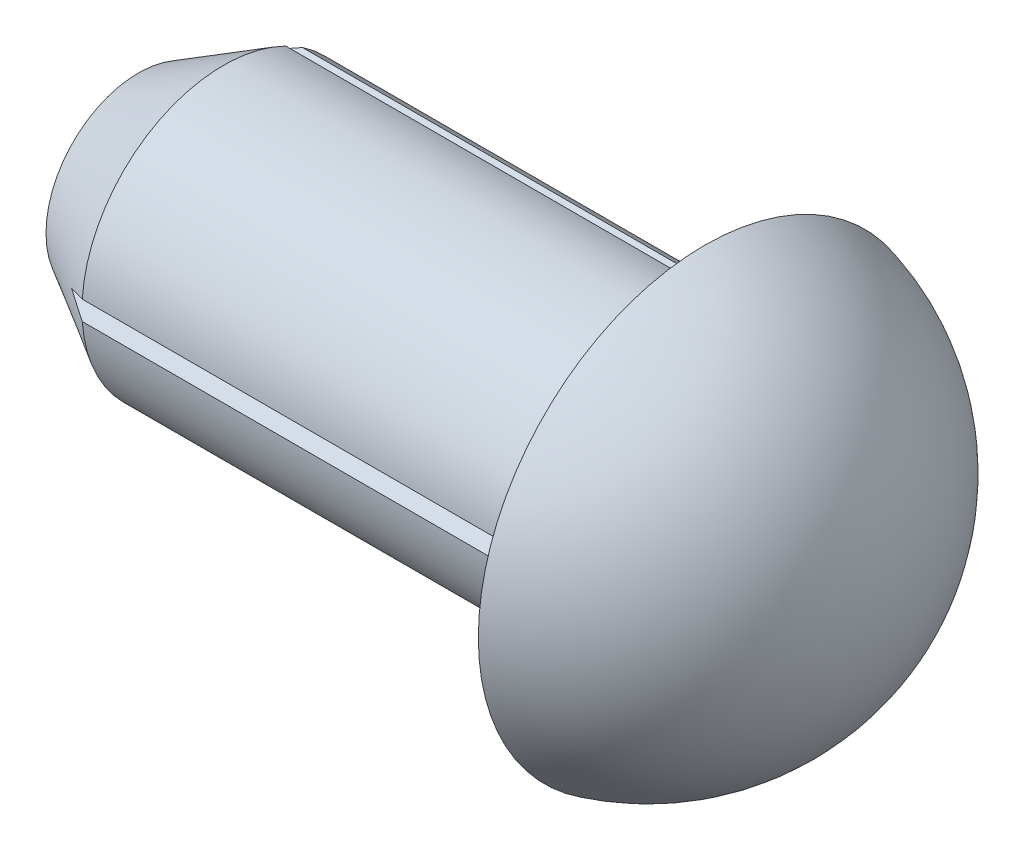
from build123d import *

# Parameters (mm, degrees)
CUT_EXTRUDE1_DEPTH = 37
CIRPATTERN1_COUNT  = 3


with BuildPart() as part:
    # Sketch1 → Base-Revolve (revolve)
    with BuildSketch(Plane.XY):
        with BuildLine():
            Line((-40, 0), (-40, 6.535898385))
            Line((-40, 6.535898385), (-34, 10))
            Line((-34, 10), (0, 10))
            Line((0, 10), (0, 16))
            ThreePointArc((0, 16), (8.983547964, 10.142395515), (12.468871126, 0))
            Line((12.468871126, 0), (-40, 0))
        make_face()
    revolve(axis=Axis((-40, 0, 0), (1, 0, 0)))

    # Sketch2 → Cut-Extrude1 (cut)
    with BuildSketch(Plane.ZY.offset(40)):
        Polygon((9, 0), (10, 0.700207538), (10, -0.700207538), align=None)
    cut_extrude1 = extrude(amount=-CUT_EXTRUDE1_DEPTH, mode=Mode.SUBTRACT)

    # CirPattern1: Cut-Extrude1 ×3 about axis
    cirpattern1_axis = Axis((-40, 0, 0), (1, 0, 0))
    for i in range(1, CIRPATTERN1_COUNT):
        add(cut_extrude1.rotate(cirpattern1_axis, i * 360 / CIRPATTERN1_COUNT), mode=Mode.SUBTRACT)


solid = part.part
